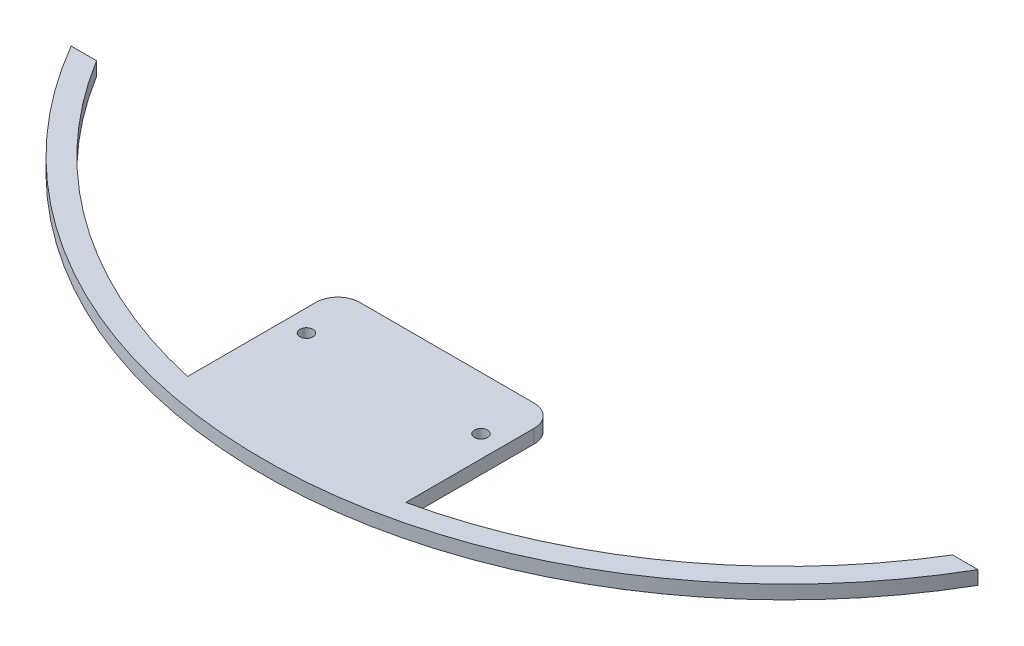
from build123d import *

# Parameters (mm, degrees)
SKETCH_1_R      = 1.5
EXTRUDE_2_DEPTH = 3.125


with BuildPart() as part:
    # 草图1 → 凸台-拉伸2 (new body)
    with BuildSketch(Plane(origin=(0, 0, 0), x_dir=(1, 0, 0), z_dir=(0, 1, 0))):
        with BuildLine():
            Line((-103.923048454, 30), (-98.107084352, 30))
            ThreePointArc((-98.107084352, 30), (-66.868130722, -3.560959239), (-25, -22.249721603))
            Line((-25, -22.249721603), (-25, 7.19346049))
            ThreePointArc((-25, 7.19346049), (-23.535533906, 10.728994396), (-20, 12.19346049))
            Line((-20, 12.19346049), (20, 12.19346049))
            ThreePointArc((20, 12.19346049), (23.535533906, 10.728994396), (25, 7.19346049))
            Line((25, 7.19346049), (25, -22.249721603))
            ThreePointArc((25, -22.249721603), (66.868130722, -3.560959239), (98.107084352, 30))
            Line((98.107084352, 30), (103.923048454, 30))
            ThreePointArc((103.923048454, 30), (0, -30), (-103.923048454, 30))
        make_face()
        with Locations((-20, 0)):
            Circle(SKETCH_1_R, mode=Mode.SUBTRACT)
        with Locations((20, 0)):
            Circle(SKETCH_1_R, mode=Mode.SUBTRACT)
    extrude(amount=EXTRUDE_2_DEPTH)


solid = part.part
